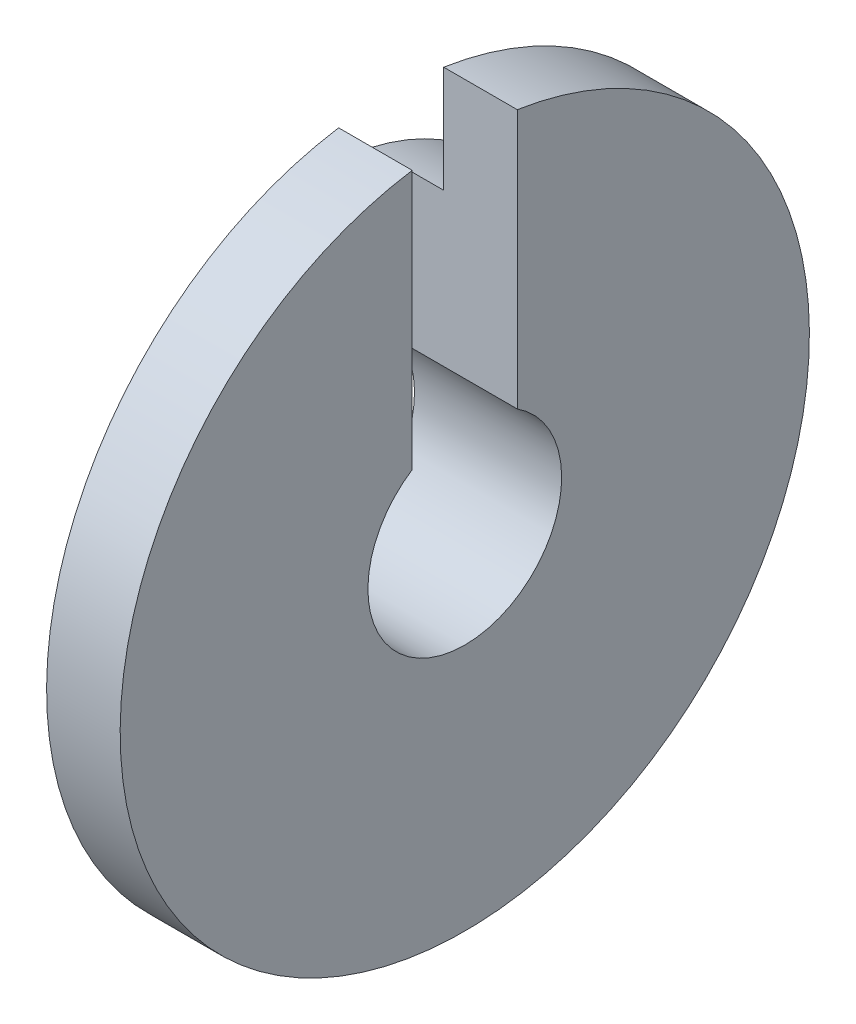
from build123d import *

# Parameters (mm, degrees)
BOSS_EXTRUDE1_DEPTH = 0.762
BOSS_EXTRUDE2_START = -1.524
BOSS_EXTRUDE2_DEPTH = 1.524


with BuildPart() as part:
    # Sketch1 → Boss-Extrude1 (new body)
    with BuildSketch(Plane(origin=(0, 0, 0), x_dir=(0, 0, -1), z_dir=(1, 0, 0))):
        with BuildLine():
            Line((0.543533241, 3.528000436), (0.543533241, 0.843316374))
            ThreePointArc((0.543533241, 0.843316374), (0.00057775, -1.003299834), (-0.544504127, 0.842689828))
            Line((-0.544504127, 0.842689828), (-0.544504127, 3.527850722))
            ThreePointArc((-0.544504127, 3.527850722), (0.000491181, -3.56962396), (0.543533241, 3.528000436))
        make_face()
    extrude(amount=BOSS_EXTRUDE1_DEPTH)

    # Sketch3 → Boss-Extrude2 (add)
    with BuildSketch(Plane(origin=(0.762, 0, 0), x_dir=(0, 0, -1), z_dir=(1, 0, 0)).offset(BOSS_EXTRUDE2_START)):
        with BuildLine():
            Line((-0.544504127, 2.423347628), (-0.544504127, 0.842689828))
            ThreePointArc((-0.544504127, 0.842689828), (0.00057775, -1.003299834), (0.543533241, 0.843316374))
            Line((0.543533241, 0.843316374), (0.543533241, 2.423565573))
            ThreePointArc((0.543533241, 2.423565573), (0.000497524, -2.483766942), (-0.544504127, 2.423347628))
        make_face()
    extrude(amount=BOSS_EXTRUDE2_DEPTH)


solid = part.part
